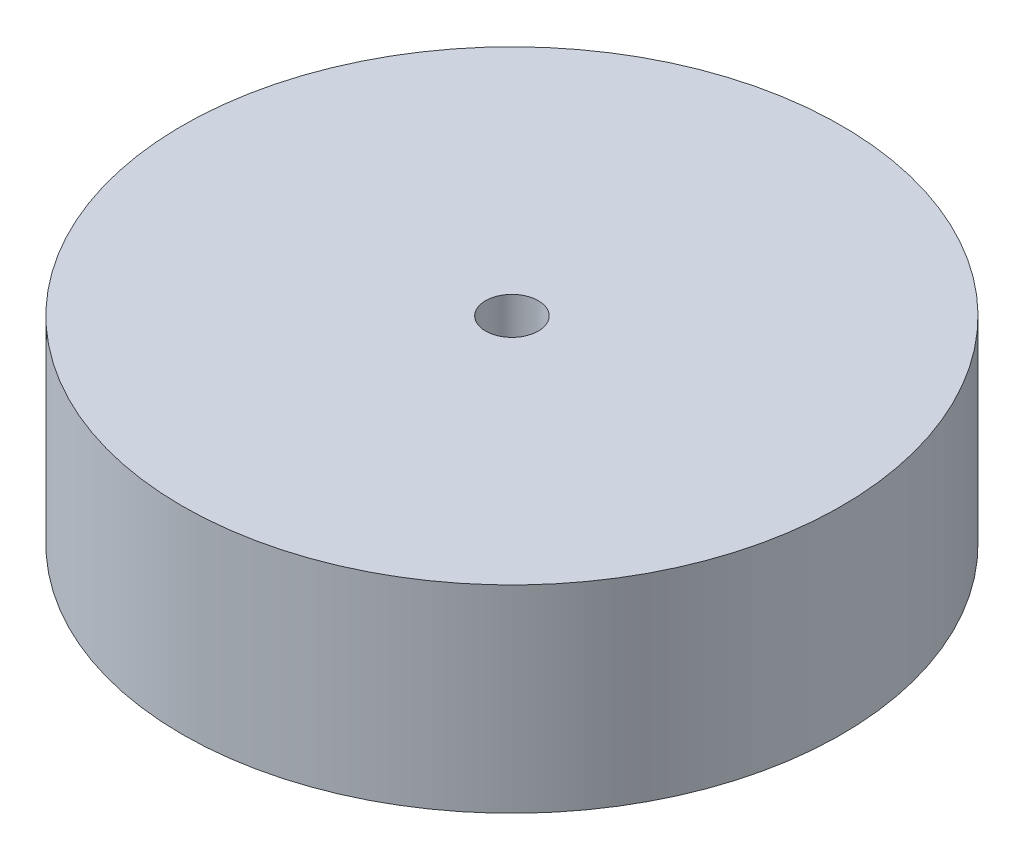
from build123d import *

# Parameters (mm, degrees)
SKETCH1_R           = 50
SKETCH1_R_2         = 4
BOSS_EXTRUDE1_DEPTH = 30


with BuildPart() as part:
    # Sketch1 → Boss-Extrude1 (new body)
    with BuildSketch(Plane(origin=(0, 0, 0), x_dir=(1, 0, 0), z_dir=(0, 1, 0))):
        Circle(SKETCH1_R)
        Circle(SKETCH1_R_2, mode=Mode.SUBTRACT)
    extrude(amount=BOSS_EXTRUDE1_DEPTH)


solid = part.part
